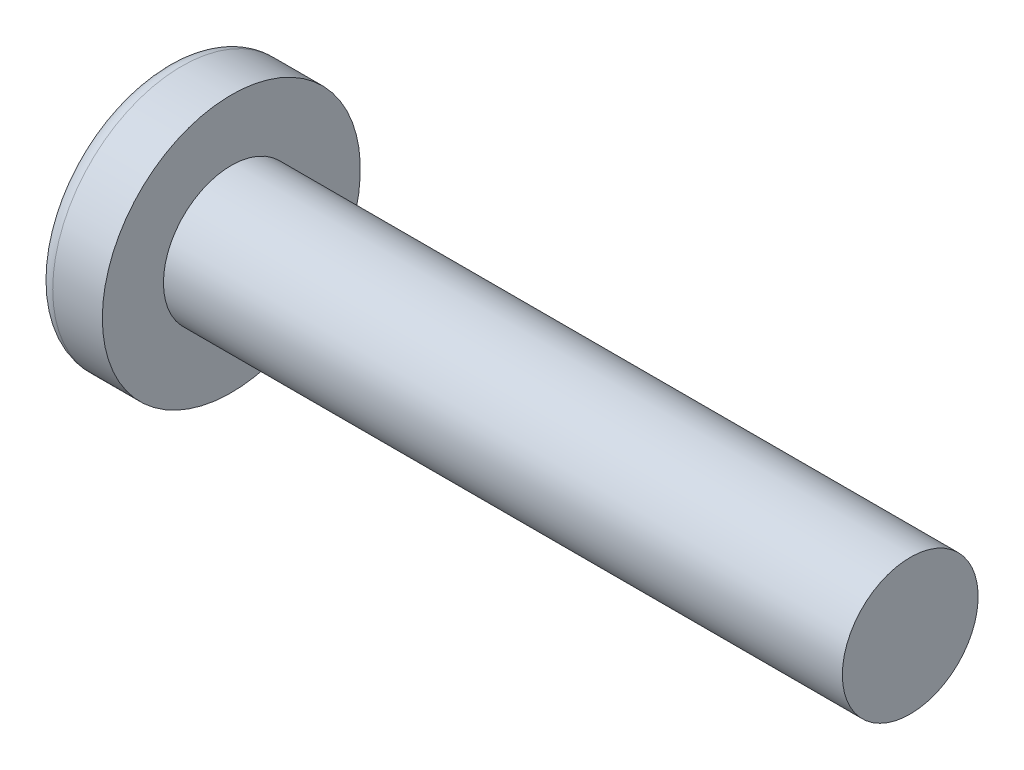
from build123d import *

# Parameters (mm, degrees)
CIRPATTERN1_COUNT = 2
CIRPATTERN1_ANGLE = 90


with BuildPart() as part:
    # BodySke → Base-Revolve (revolve)
    with BuildSketch(Plane.XY):
        with BuildLine():
            Line((3.7, 2.5), (3.7, 4.75))
            Line((3.7, 4.75), (1.873214546, 4.75))
            ThreePointArc((1.873214546, 4.75), (1.592049018, 4.680043343), (1.376448158, 4.486486486))
            ThreePointArc((1.376448158, 4.486486486), (0.351849415, 2.346442548), (0, 0))
            Line((0, 0), (28.7, 0))
            Line((28.7, 0), (28.7, 2.5))
            Line((28.7, 2.5), (3.7, 2.5))
        make_face()
    revolve(axis=Axis((-25.4, 0, 0), (1, 0, 0)))

    # Sketch3 → Cut-Loft1 section 0
    with BuildSketch(Plane(origin=(0, 0, 0), x_dir=(0, 0, -1), z_dir=(1, 0, 0))):
        with BuildLine():
            Line((0.5, -2.45), (-0.5, -2.45))
            Line((-0.5, -2.45), (-0.5, 2.45))
            Line((-0.5, 2.45), (0.5, 2.45))
            Line((0.5, 2.45), (0.5, -2.45))
        make_face()
    # Sketch4 → Cut-Loft1 section 1
    with BuildSketch(Plane(origin=(2.95, 0, 0), x_dir=(0, 0, -1), z_dir=(1, 0, 0))):
        with BuildLine():
            Line((0.25, -0.25), (-0.25, -0.25))
            Line((-0.25, -0.25), (-0.25, 0.25))
            Line((-0.25, 0.25), (0.25, 0.25))
            Line((0.25, 0.25), (0.25, -0.25))
        make_face()
    cut_loft1 = loft(mode=Mode.SUBTRACT)

    # CirPattern1: Cut-Loft1 ×2 about axis
    cirpattern1_axis = Axis((-25.4, 0, 0), (1, 0, 0))
    for i in range(1, CIRPATTERN1_COUNT):
        add(cut_loft1.rotate(cirpattern1_axis, i * CIRPATTERN1_ANGLE / (CIRPATTERN1_COUNT - 1)), mode=Mode.SUBTRACT)


solid = part.part
